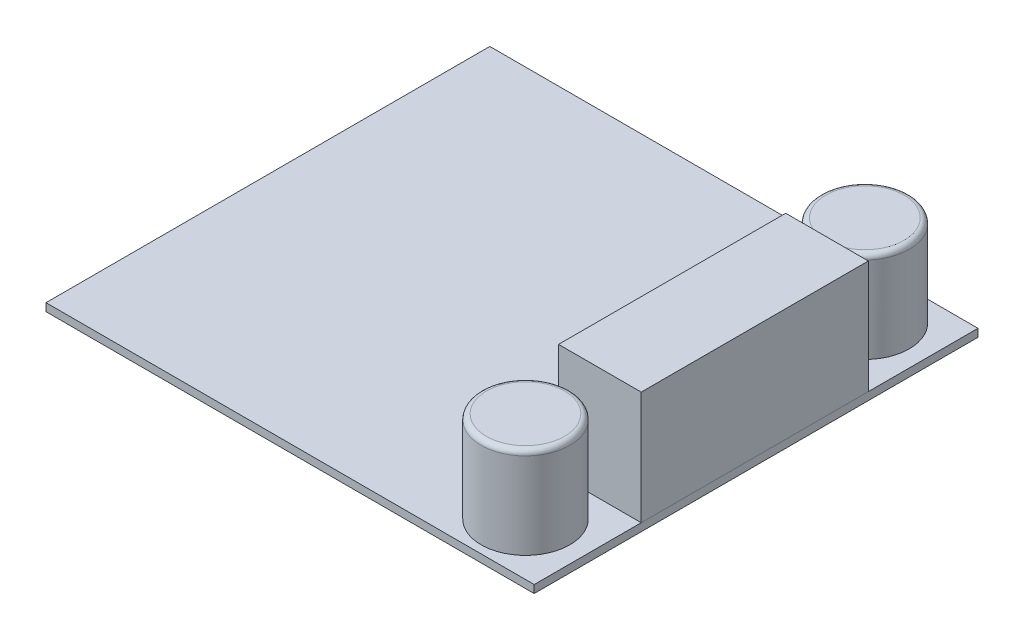
from build123d import *

# Parameters (mm, degrees)
SKIZZE1_W                       = 56.1
SKIZZE1_H                       = 51
AUFSATZ_LINEAR_AUSTRAGEN1_DEPTH = 0.9
SKIZZE2_W                       = 9.5
SKIZZE2_H                       = 26.1
AUFSATZ_LINEAR_AUSTRAGEN2_DEPTH = 13
SKIZZE3_R                       = 5.1
AUFSATZ_LINEAR_AUSTRAGEN3_DEPTH = 10.5
VERRUNDUNG1_R                   = 0.6


with BuildPart() as part:
    # Skizze1 → Aufsatz-Linear austragen1 (new body)
    with BuildSketch(Plane(origin=(0, 0, 0), x_dir=(1, 0, 0), z_dir=(0, 1, 0))):
        Rectangle(SKIZZE1_W, SKIZZE1_H)
    extrude(amount=AUFSATZ_LINEAR_AUSTRAGEN1_DEPTH)

    # Skizze3 → Aufsatz-Linear austragen3 (add)
    with BuildSketch(Plane(origin=(0, 0.9, 0), x_dir=(1, 0, 0), z_dir=(0, 1, 0))):
        with Locations((21.05, 19.5)):
            Circle(SKIZZE3_R)
        with Locations((21.05, -19.5)):
            Circle(SKIZZE3_R)
    extrude(amount=AUFSATZ_LINEAR_AUSTRAGEN3_DEPTH)

    # Verrundung1
    verrundung1_edges = [part.edges().sort_by_distance(p)[0] for p in [
        (15.95, 11.4, -19.5),
        (15.95, 11.4, 19.5),
    ]]
    fillet(verrundung1_edges, radius=VERRUNDUNG1_R)


with BuildPart() as body_2:
    # Skizze2 → Aufsatz-Linear austragen2 (new body)
    with BuildSketch(Plane(origin=(0, 0.9, 0), x_dir=(1, 0, 0), z_dir=(0, 1, 0))):
        with Locations((23.3, -0.15)):
            Rectangle(SKIZZE2_W, SKIZZE2_H)
    extrude(amount=AUFSATZ_LINEAR_AUSTRAGEN2_DEPTH)


solid = Compound([part.part, body_2.part])
